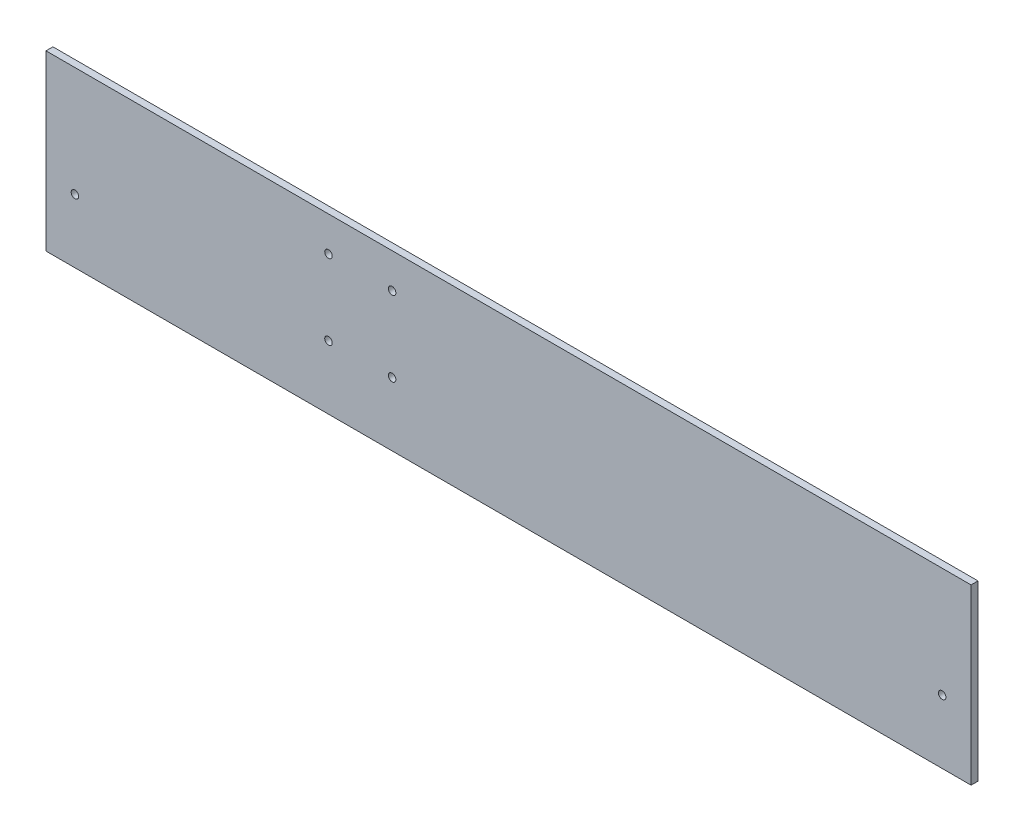
from build123d import *

# Parameters (mm, degrees)
SKETCH1_W          = 800
SKETCH1_H          = 150
BASE_FLANGE1_DEPTH = 6
SKETCH2_R          = 3.25
CUT_EXTRUDE1_DEPTH = 10
SKETCH3_R          = 3.25
CUT_EXTRUDE2_DEPTH = 408.014741748


# Sheet-metal steps are written as plain solids
with BuildPart() as part:
    # Sketch1 → Base-Flange1 (new body)
    with BuildSketch(Plane.XY):
        Rectangle(SKETCH1_W, SKETCH1_H)
    extrude(amount=-BASE_FLANGE1_DEPTH)

    # Sketch2 → Cut-Extrude1 (cut)
    with BuildSketch(Plane.XY):
        with Locations((-375, -20)):
            Circle(SKETCH2_R)
        with Locations((375, -20)):
            Circle(SKETCH2_R)
    extrude(amount=-CUT_EXTRUDE1_DEPTH, mode=Mode.SUBTRACT)

    # Sketch3 → Cut-Extrude2 (cut, through all)
    with BuildSketch(Plane.XY):
        with Locations((-100.7, 45)):
            Circle(SKETCH3_R)
        with Locations((-155.7, 45)):
            Circle(SKETCH3_R)
        with Locations((-100.7, -20)):
            Circle(SKETCH3_R)
        with Locations((-155.7, -20)):
            Circle(SKETCH3_R)
    extrude(amount=-CUT_EXTRUDE2_DEPTH, mode=Mode.SUBTRACT)


solid = part.part
